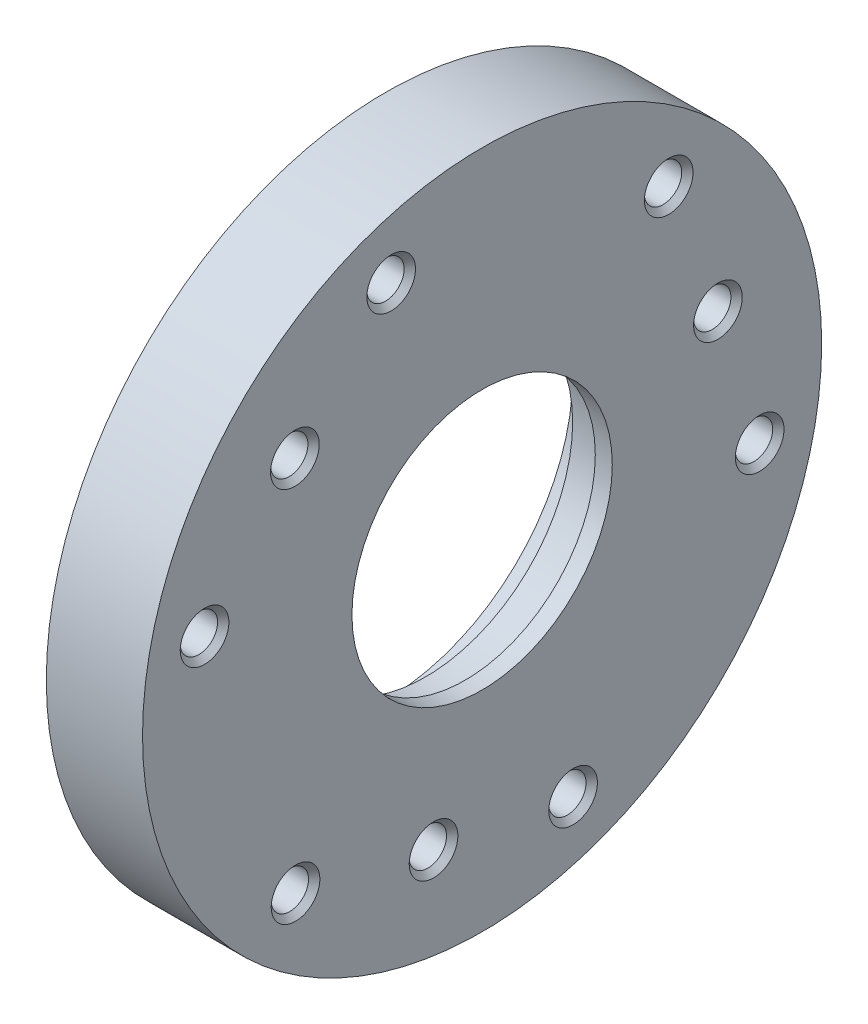
from build123d import *

# Parameters (mm, degrees)
SKETCH2_R          = 2.5
CUT_EXTRUDE1_DEPTH = 4
SKETCH3_R          = 3
CUT_EXTRUDE4_DEPTH = 87.539008545
SKETCH5_R          = 3.3
CUT_EXTRUDE6_DEPTH = 10
CHAMFER1_SIZE      = 1


with BuildPart() as part:
    # Sketch1 → Revolve1 (revolve)
    with BuildSketch(Plane.XY):
        Polygon((0, 60), (0, 33), (7, 33), (7, 26), (14, 26), (14, 23), (17, 23), (17, 60), align=None)
    revolve(axis=Axis((0, 0, 0), (1, 0, 0)))

    # Sketch2 → Cut-Extrude1 (cut)
    with BuildSketch(Plane.ZY):
        with Locations((0, 40)):
            Circle(SKETCH2_R)
        with Locations((15.307337295, 36.9551813)):
            Circle(SKETCH2_R)
        with Locations((28.284271247, 28.284271247)):
            Circle(SKETCH2_R)
        with Locations((36.9551813, 15.307337295)):
            Circle(SKETCH2_R)
        with Locations((40, 0)):
            Circle(SKETCH2_R)
        with Locations((36.9551813, -15.307337295)):
            Circle(SKETCH2_R)
        with Locations((28.284271247, -28.284271247)):
            Circle(SKETCH2_R)
        with Locations((15.307337295, -36.9551813)):
            Circle(SKETCH2_R)
        with Locations((0, -40)):
            Circle(SKETCH2_R)
        with Locations((-15.307337295, -36.9551813)):
            Circle(SKETCH2_R)
        with Locations((-28.284271247, -28.284271247)):
            Circle(SKETCH2_R)
        with Locations((-36.9551813, -15.307337295)):
            Circle(SKETCH2_R)
        with Locations((-40, 0)):
            Circle(SKETCH2_R)
        with Locations((-36.9551813, 15.307337295)):
            Circle(SKETCH2_R)
        with Locations((-28.284271247, 28.284271247)):
            Circle(SKETCH2_R)
        with Locations((-15.307337295, 36.9551813)):
            Circle(SKETCH2_R)
    extrude(amount=-CUT_EXTRUDE1_DEPTH, mode=Mode.SUBTRACT)

    # Sketch3 → Cut-Extrude4 (cut, through all)
    with BuildSketch(Plane(origin=(17, 0, 0), x_dir=(0, 0, -1), z_dir=(1, 0, 0))):
        with Locations((49.03926402, -9.754516101)):
            Circle(SKETCH3_R)
        with Locations((16.071973265, -47.346506475)):
            Circle(SKETCH3_R)
        with Locations((-32.967290755, -37.591990374)):
            Circle(SKETCH3_R)
        with Locations((-49.03926402, 9.754516101)):
            Circle(SKETCH3_R)
        with Locations((-16.071973265, 47.346506475)):
            Circle(SKETCH3_R)
        with Locations((32.967290755, 37.591990374)):
            Circle(SKETCH3_R)
    extrude(amount=-CUT_EXTRUDE4_DEPTH, mode=Mode.SUBTRACT)

    # Sketch5 → Cut-Extrude6 (cut)
    with BuildSketch(Plane(origin=(17, 0, 0), x_dir=(0, 0, -1), z_dir=(1, 0, 0))):
        with Locations((32.967290755, 37.591990374)):
            Circle(SKETCH5_R)
        with Locations((49.03926402, -9.754516101)):
            Circle(SKETCH5_R)
        with Locations((16.071973265, -47.346506475)):
            Circle(SKETCH5_R)
        with Locations((-32.967290755, -37.591990374)):
            Circle(SKETCH5_R)
        with Locations((-49.03926402, 9.754516101)):
            Circle(SKETCH5_R)
        with Locations((-16.071973265, 47.346506475)):
            Circle(SKETCH5_R)
        with Locations((41.664925698, 14.143336473)):
            Circle(SKETCH5_R)
        with Locations((-8.583974169, -43.154552338)):
            Circle(SKETCH5_R)
        with Locations((-33.080951529, 29.011215864)):
            Circle(SKETCH5_R)
    extrude(amount=-CUT_EXTRUDE6_DEPTH, mode=Mode.SUBTRACT)

    # Chamfer1
    chamfer1_edges = [part.edges().sort_by_distance(p)[0] for p in [
        (17, 47.346506475, 19.371973265),
        (17, 29.011215864, 36.380951529),
        (17, 9.754516101, 52.33926402),
        (17, -37.591990374, 36.267290755),
        (17, -43.154552338, 11.883974169),
        (17, -47.346506475, -12.771973265),
        (17, -9.754516101, -45.73926402),
        (17, 14.143336473, -38.364925698),
        (17, 37.591990374, -29.667290755),
    ]]
    chamfer(chamfer1_edges, length=CHAMFER1_SIZE)


solid = part.part
